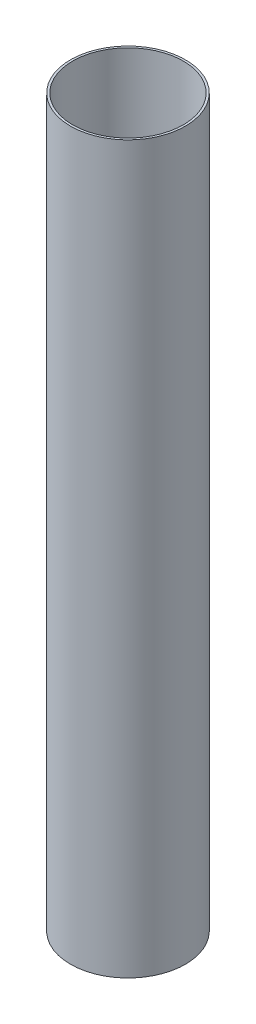
from build123d import *

# Parameters (mm, degrees)
SKETCH1_R               = 39.6
SKETCH1_R_2             = 38.1
BOSS_EXTRUDE1_DEPTH     = 500
CUT_EXTRUDE1_REACH      = 505.127
CUT_EXTRUDE1_END_RADIUS = 39.6
SKETCH2_R               = 2


with BuildPart() as part:
    # Sketch1 → Boss-Extrude1 (new body)
    with BuildSketch(Plane(origin=(0, 0, 0), x_dir=(1, 0, 0), z_dir=(0, 1, 0))):
        Circle(SKETCH1_R)
        Circle(SKETCH1_R_2, mode=Mode.SUBTRACT)
    extrude(amount=BOSS_EXTRUDE1_DEPTH)

    # Cut-Extrude1: up to this cylinder (the profile starts inside it)
    cut_extrude1_end = Plane(origin=(0, 289, 0), z_dir=(0, -1, 0)) * Cylinder(CUT_EXTRUDE1_END_RADIUS, 1090.454, mode=Mode.PRIVATE)
    # Sketch2 → Cut-Extrude1 (cut, up to the surface)
    with BuildSketch(Plane(origin=(0, 0, 0), x_dir=(0, 0, -1), z_dir=(1, 0, 0)), mode=Mode.PRIVATE) as cut_extrude1_sk1:
        with Locations((0, 289)):
            Circle(SKETCH2_R)
    cut_extrude1_tool1 = extrude(cut_extrude1_sk1.sketch, amount=-CUT_EXTRUDE1_REACH, mode=Mode.PRIVATE) & cut_extrude1_end
    add(cut_extrude1_tool1.solids().sort_by_distance((0, 289, 0))[0], mode=Mode.SUBTRACT)


solid = part.part
